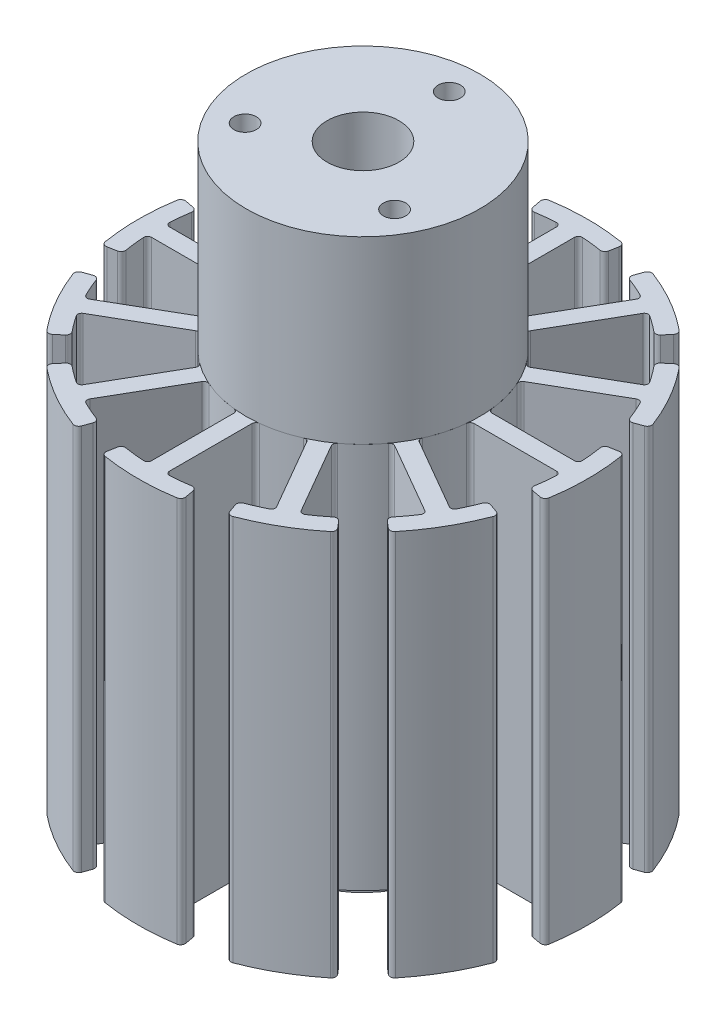
from build123d import *

# Parameters (mm, degrees)
SKETCH1_R           = 13
BOSS_EXTRUDE1_DEPTH = 20
SKETCH2_R           = 1.25
CUT_EXTRUDE1_DEPTH  = 5
BOSS_EXTRUDE2_DEPTH = 43
SKETCH6_R           = 9
BOSS_EXTRUDE3_DEPTH = 3
SKETCH7_R           = 6
CUT_EXTRUDE2_DEPTH  = 3
SKETCH8_R           = 4
CUT_EXTRUDE3_DEPTH  = 73.242646685


with BuildPart() as part:
    # Sketch1 → Boss-Extrude1 (new body)
    with BuildSketch(Plane(origin=(0, 0, 0), x_dir=(1, 0, 0), z_dir=(0, 1, 0))):
        Circle(SKETCH1_R)
    extrude(amount=BOSS_EXTRUDE1_DEPTH)

    # Sketch2 → Cut-Extrude1 (cut)
    with BuildSketch(Plane(origin=(0, 20, 0), x_dir=(1, 0, 0), z_dir=(0, 1, 0))):
        with Locations((0, 9.6)):
            Circle(SKETCH2_R)
        with Locations((8.313843876, -4.8)):
            Circle(SKETCH2_R)
        with Locations((-8.313843876, -4.8)):
            Circle(SKETCH2_R)
    extrude(amount=-CUT_EXTRUDE1_DEPTH, mode=Mode.SUBTRACT)


with BuildPart() as body_2:
    # Sketch4 → Boss-Extrude2 (new body)
    with BuildSketch(Plane.XZ):
        with BuildLine():
            ThreePointArc((1.393810622, 12.925064485), (1.112901285, 13.068912984), (1, 13.363625973))
            Line((1, 13.363625973), (1, 22.512818608))
            ThreePointArc((1, 22.512818608), (1.139323433, 22.834534733), (1.469282682, 22.953021771))
            ThreePointArc((1.469282682, 22.953021771), (2.557944672, 22.857316532), (3.640831488, 22.710005418))
            ThreePointArc((3.640831488, 22.710005418), (4.008783172, 22.795543465), (4.211879998, 23.114066429))
            Line((4.211879998, 23.114066429), (4.39118845, 24.09808009))
            ThreePointArc((4.39118845, 24.09808009), (4.307571564, 24.476340728), (3.978865765, 24.681341682))
            ThreePointArc((3.978865765, 24.681341682), (0, 25), (-3.978865765, 24.681341682))
            ThreePointArc((-3.978865765, 24.681341682), (-4.307571564, 24.476340728), (-4.39118845, 24.09808009))
            Line((-4.39118845, 24.09808009), (-4.211879998, 23.114066429))
            ThreePointArc((-4.211879998, 23.114066429), (-4.008783172, 22.795543465), (-3.640831488, 22.710005418))
            ThreePointArc((-3.640831488, 22.710005418), (-2.557944672, 22.857316532), (-1.469282682, 22.953021771))
            ThreePointArc((-1.469282682, 22.953021771), (-1.139323433, 22.834534733), (-1, 22.512818608))
            Line((-1, 22.512818608), (-1, 13.363625973))
            ThreePointArc((-1, 13.363625973), (-1.112901285, 13.068912984), (-1.393810622, 12.925064485))
            ThreePointArc((-1.393810622, 12.925064485), (-3.364647586, 12.557035742), (-5.255456836, 11.890339501))
            ThreePointArc((-5.255456836, 11.890339501), (-5.570655707, 11.874461286), (-5.815787583, 12.07323958))
            Line((-5.815787583, 12.07323958), (-10.3903839, 19.996672826))
            ThreePointArc((-10.3903839, 19.996672826), (-10.43058433, 20.344948879), (-10.204074757, 20.612541288))
            ThreePointArc((-10.204074757, 20.612541288), (-9.213413199, 21.073989115), (-8.20195015, 21.487857356))
            ThreePointArc((-8.20195015, 21.487857356), (-7.926063667, 21.74591132), (-7.909438138, 22.123308711))
            Line((-7.909438138, 22.123308711), (-8.246159295, 23.065143765))
            ThreePointArc((-8.246159295, 23.065143765), (-8.50770396, 23.350918644), (-8.89487201, 23.364101779))
            ThreePointArc((-8.89487201, 23.364101779), (-12.5, 21.650635095), (-15.786469672, 19.385236014))
            ThreePointArc((-15.786469672, 19.385236014), (-15.968636767, 19.04334708), (-15.851920795, 18.673955315))
            Line((-15.851920795, 18.673955315), (-15.204628291, 17.911428713))
            ThreePointArc((-15.204628291, 17.911428713), (-14.869479798, 17.737128148), (-14.508055268, 17.847025868))
            ThreePointArc((-14.508055268, 17.847025868), (-13.643903333, 18.516044443), (-12.748947013, 19.143258606))
            ThreePointArc((-12.748947013, 19.143258606), (-12.403950403, 19.205625446), (-12.122434708, 18.996672826))
            Line((-12.122434708, 18.996672826), (-7.54783839, 11.07323958))
            ThreePointArc((-7.54783839, 11.07323958), (-7.498257276, 10.761560002), (-7.669607649, 10.496528879))
            ThreePointArc((-7.669607649, 10.496528879), (-9.192388155, 9.192388155), (-10.496528879, 7.669607649))
            ThreePointArc((-10.496528879, 7.669607649), (-10.761560002, 7.498257276), (-11.07323958, 7.54783839))
            Line((-11.07323958, 7.54783839), (-18.996672826, 12.122434708))
            ThreePointArc((-18.996672826, 12.122434708), (-19.205625446, 12.403950403), (-19.143258606, 12.748947013))
            ThreePointArc((-19.143258606, 12.748947013), (-18.516044443, 13.643903333), (-17.847025868, 14.508055268))
            ThreePointArc((-17.847025868, 14.508055268), (-17.737128148, 14.869479798), (-17.911428713, 15.204628291))
            Line((-17.911428713, 15.204628291), (-18.673955315, 15.851920795))
            ThreePointArc((-18.673955315, 15.851920795), (-19.04334708, 15.968636767), (-19.385236014, 15.786469672))
            ThreePointArc((-19.385236014, 15.786469672), (-21.650635095, 12.5), (-23.364101779, 8.89487201))
            ThreePointArc((-23.364101779, 8.89487201), (-23.350918644, 8.50770396), (-23.065143765, 8.246159295))
            Line((-23.065143765, 8.246159295), (-22.123308711, 7.909438138))
            ThreePointArc((-22.123308711, 7.909438138), (-21.74591132, 7.926063667), (-21.487857356, 8.20195015))
            ThreePointArc((-21.487857356, 8.20195015), (-21.073989115, 9.213413199), (-20.612541288, 10.204074757))
            ThreePointArc((-20.612541288, 10.204074757), (-20.344948879, 10.43058433), (-19.996672826, 10.3903839))
            Line((-19.996672826, 10.3903839), (-12.07323958, 5.815787583))
            ThreePointArc((-12.07323958, 5.815787583), (-11.874461286, 5.570655707), (-11.890339501, 5.255456836))
            ThreePointArc((-11.890339501, 5.255456836), (-12.557035742, 3.364647586), (-12.925064485, 1.393810622))
            ThreePointArc((-12.925064485, 1.393810622), (-13.068912984, 1.112901285), (-13.363625973, 1))
            Line((-13.363625973, 1), (-22.512818608, 1))
            ThreePointArc((-22.512818608, 1), (-22.834534733, 1.139323433), (-22.953021771, 1.469282682))
            ThreePointArc((-22.953021771, 1.469282682), (-22.857316532, 2.557944672), (-22.710005418, 3.640831488))
            ThreePointArc((-22.710005418, 3.640831488), (-22.795543465, 4.008783172), (-23.114066429, 4.211879998))
            Line((-23.114066429, 4.211879998), (-24.09808009, 4.39118845))
            ThreePointArc((-24.09808009, 4.39118845), (-24.476340728, 4.307571564), (-24.681341682, 3.978865765))
            ThreePointArc((-24.681341682, 3.978865765), (-25, 0), (-24.681341682, -3.978865765))
            ThreePointArc((-24.681341682, -3.978865765), (-24.476340728, -4.307571564), (-24.09808009, -4.39118845))
            Line((-24.09808009, -4.39118845), (-23.114066429, -4.211879998))
            ThreePointArc((-23.114066429, -4.211879998), (-22.795543465, -4.008783172), (-22.710005418, -3.640831488))
            ThreePointArc((-22.710005418, -3.640831488), (-22.857316532, -2.557944672), (-22.953021771, -1.469282682))
            ThreePointArc((-22.953021771, -1.469282682), (-22.834534733, -1.139323433), (-22.512818608, -1))
            Line((-22.512818608, -1), (-13.363625973, -1))
            ThreePointArc((-13.363625973, -1), (-13.068912984, -1.112901285), (-12.925064485, -1.393810622))
            ThreePointArc((-12.925064485, -1.393810622), (-12.557035742, -3.364647586), (-11.890339501, -5.255456836))
            ThreePointArc((-11.890339501, -5.255456836), (-11.874461286, -5.570655707), (-12.07323958, -5.815787583))
            Line((-12.07323958, -5.815787583), (-19.996672826, -10.3903839))
            ThreePointArc((-19.996672826, -10.3903839), (-20.344948879, -10.43058433), (-20.612541288, -10.204074757))
            ThreePointArc((-20.612541288, -10.204074757), (-21.073989115, -9.213413199), (-21.487857356, -8.20195015))
            ThreePointArc((-21.487857356, -8.20195015), (-21.74591132, -7.926063667), (-22.123308711, -7.909438138))
            Line((-22.123308711, -7.909438138), (-23.065143765, -8.246159295))
            ThreePointArc((-23.065143765, -8.246159295), (-23.350918644, -8.50770396), (-23.364101779, -8.89487201))
            ThreePointArc((-23.364101779, -8.89487201), (-21.650635095, -12.5), (-19.385236014, -15.786469672))
            ThreePointArc((-19.385236014, -15.786469672), (-19.04334708, -15.968636767), (-18.673955315, -15.851920795))
            Line((-18.673955315, -15.851920795), (-17.911428713, -15.204628291))
            ThreePointArc((-17.911428713, -15.204628291), (-17.737128148, -14.869479798), (-17.847025868, -14.508055268))
            ThreePointArc((-17.847025868, -14.508055268), (-18.516044443, -13.643903333), (-19.143258606, -12.748947013))
            ThreePointArc((-19.143258606, -12.748947013), (-19.205625446, -12.403950403), (-18.996672826, -12.122434708))
            Line((-18.996672826, -12.122434708), (-11.07323958, -7.54783839))
            ThreePointArc((-11.07323958, -7.54783839), (-10.761560002, -7.498257276), (-10.496528879, -7.669607649))
            ThreePointArc((-10.496528879, -7.669607649), (-9.192388155, -9.192388155), (-7.669607649, -10.496528879))
            ThreePointArc((-7.669607649, -10.496528879), (-7.498257276, -10.761560002), (-7.54783839, -11.07323958))
            Line((-7.54783839, -11.07323958), (-12.122434708, -18.996672826))
            ThreePointArc((-12.122434708, -18.996672826), (-12.403950403, -19.205625446), (-12.748947013, -19.143258606))
            ThreePointArc((-12.748947013, -19.143258606), (-13.643903333, -18.516044443), (-14.508055268, -17.847025868))
            ThreePointArc((-14.508055268, -17.847025868), (-14.869479798, -17.737128148), (-15.204628291, -17.911428713))
            Line((-15.204628291, -17.911428713), (-15.851920795, -18.673955315))
            ThreePointArc((-15.851920795, -18.673955315), (-15.968636767, -19.04334708), (-15.786469672, -19.385236014))
            ThreePointArc((-15.786469672, -19.385236014), (-12.5, -21.650635095), (-8.89487201, -23.364101779))
            ThreePointArc((-8.89487201, -23.364101779), (-8.50770396, -23.350918644), (-8.246159295, -23.065143765))
            Line((-8.246159295, -23.065143765), (-7.909438138, -22.123308711))
            ThreePointArc((-7.909438138, -22.123308711), (-7.926063667, -21.74591132), (-8.20195015, -21.487857356))
            ThreePointArc((-8.20195015, -21.487857356), (-9.213413199, -21.073989115), (-10.204074757, -20.612541288))
            ThreePointArc((-10.204074757, -20.612541288), (-10.43058433, -20.344948879), (-10.3903839, -19.996672826))
            Line((-10.3903839, -19.996672826), (-5.815787583, -12.07323958))
            ThreePointArc((-5.815787583, -12.07323958), (-5.570655707, -11.874461286), (-5.255456836, -11.890339501))
            ThreePointArc((-5.255456836, -11.890339501), (-3.364647586, -12.557035742), (-1.393810622, -12.925064485))
            ThreePointArc((-1.393810622, -12.925064485), (-1.112901285, -13.068912984), (-1, -13.363625973))
            Line((-1, -13.363625973), (-1, -22.512818608))
            ThreePointArc((-1, -22.512818608), (-1.139323433, -22.834534733), (-1.469282682, -22.953021771))
            ThreePointArc((-1.469282682, -22.953021771), (-2.557944672, -22.857316532), (-3.640831488, -22.710005418))
            ThreePointArc((-3.640831488, -22.710005418), (-4.008783172, -22.795543465), (-4.211879998, -23.114066429))
            Line((-4.211879998, -23.114066429), (-4.39118845, -24.09808009))
            ThreePointArc((-4.39118845, -24.09808009), (-4.307571564, -24.476340728), (-3.978865765, -24.681341682))
            ThreePointArc((-3.978865765, -24.681341682), (0, -25), (3.978865765, -24.681341682))
            ThreePointArc((3.978865765, -24.681341682), (4.307571564, -24.476340728), (4.39118845, -24.09808009))
            Line((4.39118845, -24.09808009), (4.211879998, -23.114066429))
            ThreePointArc((4.211879998, -23.114066429), (4.008783172, -22.795543465), (3.640831488, -22.710005418))
            ThreePointArc((3.640831488, -22.710005418), (2.557944672, -22.857316532), (1.469282682, -22.953021771))
            ThreePointArc((1.469282682, -22.953021771), (1.139323433, -22.834534733), (1, -22.512818608))
            Line((1, -22.512818608), (1, -13.363625973))
            ThreePointArc((1, -13.363625973), (1.112901285, -13.068912984), (1.393810622, -12.925064485))
            ThreePointArc((1.393810622, -12.925064485), (3.364647586, -12.557035742), (5.255456836, -11.890339501))
            ThreePointArc((5.255456836, -11.890339501), (5.570655707, -11.874461286), (5.815787583, -12.07323958))
            Line((5.815787583, -12.07323958), (10.3903839, -19.996672826))
            ThreePointArc((10.3903839, -19.996672826), (10.43058433, -20.344948879), (10.204074757, -20.612541288))
            ThreePointArc((10.204074757, -20.612541288), (9.213413199, -21.073989115), (8.20195015, -21.487857356))
            ThreePointArc((8.20195015, -21.487857356), (7.926063667, -21.74591132), (7.909438138, -22.123308711))
            Line((7.909438138, -22.123308711), (8.246159295, -23.065143765))
            ThreePointArc((8.246159295, -23.065143765), (8.50770396, -23.350918644), (8.89487201, -23.364101779))
            ThreePointArc((8.89487201, -23.364101779), (12.5, -21.650635095), (15.786469672, -19.385236014))
            ThreePointArc((15.786469672, -19.385236014), (15.968636767, -19.04334708), (15.851920795, -18.673955315))
            Line((15.851920795, -18.673955315), (15.204628291, -17.911428713))
            ThreePointArc((15.204628291, -17.911428713), (14.869479798, -17.737128148), (14.508055268, -17.847025868))
            ThreePointArc((14.508055268, -17.847025868), (13.643903333, -18.516044443), (12.748947013, -19.143258606))
            ThreePointArc((12.748947013, -19.143258606), (12.403950403, -19.205625446), (12.122434708, -18.996672826))
            Line((12.122434708, -18.996672826), (7.54783839, -11.07323958))
            ThreePointArc((7.54783839, -11.07323958), (7.498257276, -10.761560002), (7.669607649, -10.496528879))
            ThreePointArc((7.669607649, -10.496528879), (9.192388155, -9.192388155), (10.496528879, -7.669607649))
            ThreePointArc((10.496528879, -7.669607649), (10.761560002, -7.498257276), (11.07323958, -7.54783839))
            Line((11.07323958, -7.54783839), (18.996672826, -12.122434708))
            ThreePointArc((18.996672826, -12.122434708), (19.205625446, -12.403950403), (19.143258606, -12.748947013))
            ThreePointArc((19.143258606, -12.748947013), (18.516044443, -13.643903333), (17.847025868, -14.508055268))
            ThreePointArc((17.847025868, -14.508055268), (17.737128148, -14.869479798), (17.911428713, -15.204628291))
            Line((17.911428713, -15.204628291), (18.673955315, -15.851920795))
            ThreePointArc((18.673955315, -15.851920795), (19.04334708, -15.968636767), (19.385236014, -15.786469672))
            ThreePointArc((19.385236014, -15.786469672), (21.650635095, -12.5), (23.364101779, -8.89487201))
            ThreePointArc((23.364101779, -8.89487201), (23.350918644, -8.50770396), (23.065143765, -8.246159295))
            Line((23.065143765, -8.246159295), (22.123308711, -7.909438138))
            ThreePointArc((22.123308711, -7.909438138), (21.74591132, -7.926063667), (21.487857356, -8.20195015))
            ThreePointArc((21.487857356, -8.20195015), (21.073989115, -9.213413199), (20.612541288, -10.204074757))
            ThreePointArc((20.612541288, -10.204074757), (20.344948879, -10.43058433), (19.996672826, -10.3903839))
            Line((19.996672826, -10.3903839), (12.07323958, -5.815787583))
            ThreePointArc((12.07323958, -5.815787583), (11.874461286, -5.570655707), (11.890339501, -5.255456836))
            ThreePointArc((11.890339501, -5.255456836), (12.557035742, -3.364647586), (12.925064485, -1.393810622))
            ThreePointArc((12.925064485, -1.393810622), (13.068912984, -1.112901285), (13.363625973, -1))
            Line((13.363625973, -1), (22.512818608, -1))
            ThreePointArc((22.512818608, -1), (22.834534733, -1.139323433), (22.953021771, -1.469282682))
            ThreePointArc((22.953021771, -1.469282682), (22.857316532, -2.557944672), (22.710005418, -3.640831488))
            ThreePointArc((22.710005418, -3.640831488), (22.795543465, -4.008783172), (23.114066429, -4.211879998))
            Line((23.114066429, -4.211879998), (24.09808009, -4.39118845))
            ThreePointArc((24.09808009, -4.39118845), (24.476340728, -4.307571564), (24.681341682, -3.978865765))
            ThreePointArc((24.681341682, -3.978865765), (25, 0), (24.681341682, 3.978865765))
            ThreePointArc((24.681341682, 3.978865765), (24.476340728, 4.307571564), (24.09808009, 4.39118845))
            Line((24.09808009, 4.39118845), (23.114066429, 4.211879998))
            ThreePointArc((23.114066429, 4.211879998), (22.795543465, 4.008783172), (22.710005418, 3.640831488))
            ThreePointArc((22.710005418, 3.640831488), (22.857316532, 2.557944672), (22.953021771, 1.469282682))
            ThreePointArc((22.953021771, 1.469282682), (22.834534733, 1.139323433), (22.512818608, 1))
            Line((22.512818608, 1), (13.363625973, 1))
            ThreePointArc((13.363625973, 1), (13.068912984, 1.112901285), (12.925064485, 1.393810622))
            ThreePointArc((12.925064485, 1.393810622), (12.557035742, 3.364647586), (11.890339501, 5.255456836))
            ThreePointArc((11.890339501, 5.255456836), (11.874461286, 5.570655707), (12.07323958, 5.815787583))
            Line((12.07323958, 5.815787583), (19.996672826, 10.3903839))
            ThreePointArc((19.996672826, 10.3903839), (20.344948879, 10.43058433), (20.612541288, 10.204074757))
            ThreePointArc((20.612541288, 10.204074757), (21.073989115, 9.213413199), (21.487857356, 8.20195015))
            ThreePointArc((21.487857356, 8.20195015), (21.74591132, 7.926063667), (22.123308711, 7.909438138))
            Line((22.123308711, 7.909438138), (23.065143765, 8.246159295))
            ThreePointArc((23.065143765, 8.246159295), (23.350918644, 8.50770396), (23.364101779, 8.89487201))
            ThreePointArc((23.364101779, 8.89487201), (21.650635095, 12.5), (19.385236014, 15.786469672))
            ThreePointArc((19.385236014, 15.786469672), (19.04334708, 15.968636767), (18.673955315, 15.851920795))
            Line((18.673955315, 15.851920795), (17.911428713, 15.204628291))
            ThreePointArc((17.911428713, 15.204628291), (17.737128148, 14.869479798), (17.847025868, 14.508055268))
            ThreePointArc((17.847025868, 14.508055268), (18.516044443, 13.643903333), (19.143258606, 12.748947013))
            ThreePointArc((19.143258606, 12.748947013), (19.205625446, 12.403950403), (18.996672826, 12.122434708))
            Line((18.996672826, 12.122434708), (11.07323958, 7.54783839))
            ThreePointArc((11.07323958, 7.54783839), (10.761560002, 7.498257276), (10.496528879, 7.669607649))
            ThreePointArc((10.496528879, 7.669607649), (9.192388155, 9.192388155), (7.669607649, 10.496528879))
            ThreePointArc((7.669607649, 10.496528879), (7.498257276, 10.761560002), (7.54783839, 11.07323958))
            Line((7.54783839, 11.07323958), (12.122434708, 18.996672826))
            ThreePointArc((12.122434708, 18.996672826), (12.403950403, 19.205625446), (12.748947013, 19.143258606))
            ThreePointArc((12.748947013, 19.143258606), (13.643903333, 18.516044443), (14.508055268, 17.847025868))
            ThreePointArc((14.508055268, 17.847025868), (14.869479798, 17.737128148), (15.204628291, 17.911428713))
            Line((15.204628291, 17.911428713), (15.851920795, 18.673955315))
            ThreePointArc((15.851920795, 18.673955315), (15.968636767, 19.04334708), (15.786469672, 19.385236014))
            ThreePointArc((15.786469672, 19.385236014), (12.5, 21.650635095), (8.89487201, 23.364101779))
            ThreePointArc((8.89487201, 23.364101779), (8.50770396, 23.350918644), (8.246159295, 23.065143765))
            Line((8.246159295, 23.065143765), (7.909438138, 22.123308711))
            ThreePointArc((7.909438138, 22.123308711), (7.926063667, 21.74591132), (8.20195015, 21.487857356))
            ThreePointArc((8.20195015, 21.487857356), (9.213413199, 21.073989115), (10.204074757, 20.612541288))
            ThreePointArc((10.204074757, 20.612541288), (10.43058433, 20.344948879), (10.3903839, 19.996672826))
            Line((10.3903839, 19.996672826), (5.815787583, 12.07323958))
            ThreePointArc((5.815787583, 12.07323958), (5.570655707, 11.874461286), (5.255456836, 11.890339501))
            ThreePointArc((5.255456836, 11.890339501), (3.364647586, 12.557035742), (1.393810622, 12.925064485))
        make_face()
    extrude(amount=BOSS_EXTRUDE2_DEPTH)

    # Sketch6 → Boss-Extrude3 (add)
    with BuildSketch(Plane(origin=(0, -43, 0), x_dir=(-1, 0, 0), z_dir=(0, -1, 0))):
        Circle(SKETCH6_R)
    extrude(amount=BOSS_EXTRUDE3_DEPTH)

    # Sketch7 → Cut-Extrude2 (cut)
    with BuildSketch(Plane(origin=(0, -46, 0), x_dir=(-1, 0, 0), z_dir=(0, -1, 0))):
        Circle(SKETCH7_R)
    extrude(amount=-CUT_EXTRUDE2_DEPTH, mode=Mode.SUBTRACT)


with BuildPart() as cut_extrude3_tool:
    # Sketch8 → Cut-Extrude3 (new, through all)
    with BuildSketch(Plane(origin=(0, -43, 0), x_dir=(-1, 0, 0), z_dir=(0, -1, 0))):
        Circle(SKETCH8_R)
    extrude(amount=-CUT_EXTRUDE3_DEPTH)


with BuildPart() as part_1:
    add(part.part)

    # Cut-Extrude3: cut by cut_extrude3_tool
    add(cut_extrude3_tool.part, mode=Mode.SUBTRACT)


with BuildPart() as body_2_1:
    add(body_2.part)

    # Cut-Extrude3: cut by cut_extrude3_tool
    add(cut_extrude3_tool.part, mode=Mode.SUBTRACT)


solid = Compound([part_1.part, body_2_1.part])
